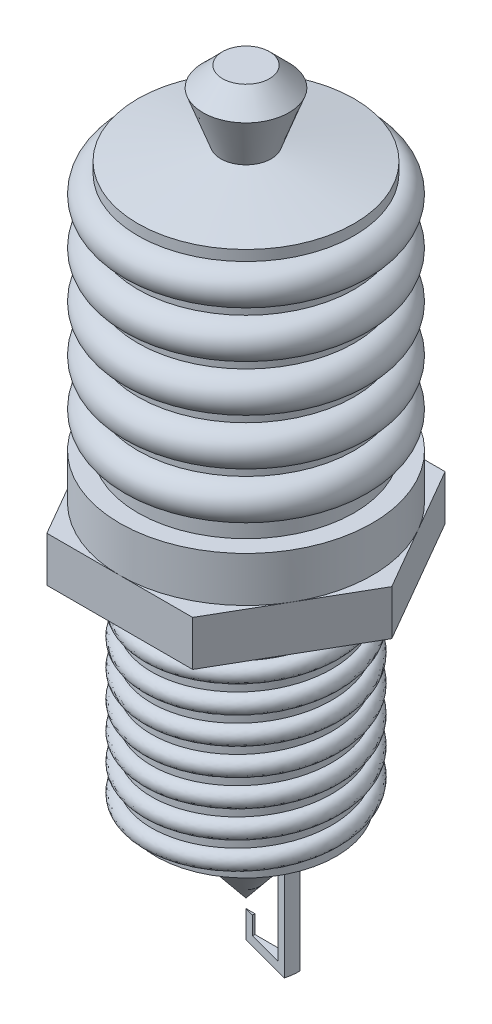
from build123d import *

# Parameters (mm, degrees)
BOSS_EXTRUDE1_DEPTH = 63.5
FILLET3_R           = 50.8
SKETCH3_R           = 177.8
BOSS_EXTRUDE2_DEPTH = 63.5
SWEEP1_PITCH        = 38.1
REVOLVE_THIN1_ANGLE = 15


with BuildPart() as part:
    # Sketch1 → Revolve1 (revolve)
    with BuildSketch(Plane.XY, mode=Mode.PRIVATE) as revolve1_sk:
        with BuildLine():
            Line((0, 1016), (0, 0))
            Line((0, 0), (92.71, 114.3))
            Line((92.71, 114.3), (127, 114.3))
            Line((127, 114.3), (127, 419.1))
            Line((127, 419.1), (88.9, 419.1))
            Line((88.9, 419.1), (88.9, 546.1))
            Line((88.9, 546.1), (152.4, 546.1))
            Line((152.4, 546.1), (152.4, 571.217955574))
            ThreePointArc((152.4, 571.217955574), (177.8, 596.617955574), (152.4, 622.017955574))
            Line((152.4, 622.017955574), (152.4, 636.749955574))
            ThreePointArc((152.4, 636.749955574), (177.8, 662.149955574), (152.4, 687.549955574))
            Line((152.4, 687.549955574), (152.4, 702.281955574))
            ThreePointArc((152.4, 702.281955574), (177.8, 727.681955574), (152.4, 753.081955574))
            Line((152.4, 753.081955574), (152.4, 767.813955574))
            ThreePointArc((152.4, 767.813955574), (177.8, 793.213955574), (152.4, 818.613955574))
            Line((152.4, 818.613955574), (152.4, 833.345955574))
            ThreePointArc((152.4, 833.345955574), (177.8, 858.745955574), (152.4, 884.145955574))
            Line((152.4, 884.145955574), (152.4, 898.877955574))
            Line((152.4, 898.877955574), (35.56, 919.48))
            Line((35.56, 919.48), (60.638203143, 988.381796857))
            Line((60.638203143, 988.381796857), (33.02, 1016))
            Line((33.02, 1016), (0, 1016))
        make_face()
    revolve(revolve1_sk.sketch.rotate(Axis((0, 1016, 0), (0, -1, 0)), 90), axis=Axis((0, 1016, 0), (0, -1, 0)))

    # Sketch2 → Boss-Extrude1 (add)
    with BuildSketch(Plane(origin=(0, 419.1, 0), x_dir=(1, 0, 0), z_dir=(0, 1, 0))):
        Polygon((102.652877862, 177.8), (-102.652877862, 177.8), (-205.305755724, 0), (-102.652877862, -177.8), (102.652877862, -177.8), (205.305755724, 0), align=None)
    extrude(amount=BOSS_EXTRUDE1_DEPTH)

    # Fillet3
    fillet3_edges = [part.edges().sort_by_distance(p)[0] for p in [
        (0, 114.3, -92.71),
    ]]
    fillet(fillet3_edges, radius=FILLET3_R)

    # Sketch3 → Boss-Extrude2 (add)
    with BuildSketch(Plane(origin=(0, 482.6, 0), x_dir=(1, 0, 0), z_dir=(0, 1, 0))):
        with Locations(Location((0, 0, 0), (0, 0, 270))):
            Circle(SKETCH3_R)
    extrude(amount=BOSS_EXTRUDE2_DEPTH)

    # Sweep1: arcs per turn and ends read off the stored shape
    # Sweep1: the profile of Sketch10 screwed along a right-hand helix through 7.75 turns, 24 arcs to a turn; built about Z, then put on its axis
    sweep1_z = Axis((0, 0, 0), (0, 0, 1))
    sweep1_corners = [(114.3, -0.002356687, 0.049358328), (127, -0.608047009, 12.734906769), (139.7, -0.002356687, 0.049358328), (127, 0.603333635, -12.636190112)]
    with BuildLine(mode=Mode.PRIVATE) as sweep1_profile:
        ThreePointArc((114.3, -0.002356687, 0.049358328), (118.019743879, -0.430644421, 9.019395653), (127, -0.608047009, 12.734906769))
        ThreePointArc((127, -0.608047009, 12.734906769), (135.980256121, -0.430644421, 9.019395653), (139.7, -0.002356687, 0.049358328))
        ThreePointArc((139.7, -0.002356687, 0.049358328), (135.980256121, 0.425931047, -8.920678997), (127, 0.603333635, -12.636190112))
        ThreePointArc((127, 0.603333635, -12.636190112), (118.019743879, 0.425931047, -8.920678997), (114.3, -0.002356687, 0.049358328))
    sweep1_cap = Face(sweep1_profile.wire())
    sweep1_arcs = [((114.3, -0.002356687, 0.049358328), (114.3, -0.608047009, 12.734906769), (127, -0.608047009, 12.734906769), (1, 0.7071067811865475, 1)), ((127, -0.608047009, 12.734906769), (139.7, -0.608047009, 12.734906769), (139.7, -0.002356687, 0.049358328), (1, 0.7071067811865475, 1)), ((139.7, -0.002356687, 0.049358328), (139.7, 0.603333635, -12.636190112), (127, 0.603333635, -12.636190112), (1, 0.7071067811865475, 1)), ((127, 0.603333635, -12.636190112), (114.3, 0.603333635, -12.636190112), (114.3, -0.002356687, 0.049358328), (1, 0.7071067811865475, 1))]  # start, shoulder, end, weights
    sweep1_turn_angles = [0, 7.5, 15, 22.5, 30, 37.5, 45, 52.5, 60, 67.5, 75, 82.5, 90, 97.5, 105, 112.5, 120, 127.5, 135, 142.5, 150, 157.5, 165, 172.5, 180, 187.5, 195, 202.5, 210, 217.5, 225, 232.5, 240, 247.5, 255, 262.5, 270, 277.5, 285, 292.5, 300, 307.5, 315, 322.5, 330, 337.5, 345, 352.5, 360]
    sweep1_turn_weights = [1, 0.9914448613738104, 1, 0.9914448613738104, 1, 0.9914448613738104, 1, 0.9914448613738104, 1, 0.9914448613738104, 1, 0.9914448613738104, 1, 0.9914448613738104, 1, 0.9914448613738104, 1, 0.9914448613738104, 1, 0.9914448613738104, 1, 0.9914448613738104, 1, 0.9914448613738104, 1, 0.9914448613738104, 1, 0.9914448613738104, 1, 0.9914448613738104, 1, 0.9914448613738104, 1, 0.9914448613738104, 1, 0.9914448613738104, 1, 0.9914448613738104, 1, 0.9914448613738104, 1, 0.9914448613738104, 1, 0.9914448613738104, 1, 0.9914448613738104, 1, 0.9914448613738104, 1]
    sweep1_turn_sides = [Face.make_bezier_surface([[Vector(p[j][0], p[j][1], 0).rotate(sweep1_z, sweep1_turn_angles[2 * i + k]) / sweep1_turn_weights[2 * i + k] + Vector(0, 0, p[j][2] + SWEEP1_PITCH * sweep1_turn_angles[2 * i + k] / 360) for k in range(3)] for j in range(3)], [[p[3][j] * sweep1_turn_weights[2 * i + k] for k in range(3)] for j in range(3)]) for p in sweep1_arcs for i in range(24)]
    sweep1_last_angles = [2520, 2527.5, 2535, 2542.5, 2550, 2557.5, 2565, 2572.5, 2580, 2587.5, 2595, 2602.5, 2610, 2617.5, 2625, 2632.5, 2640, 2647.5, 2655, 2662.5, 2670, 2677.5, 2685, 2692.5, 2700, 2707.5, 2715, 2722.5, 2730, 2737.5, 2745, 2752.5, 2760, 2767.5, 2775, 2782.5, 2790]
    sweep1_last_weights = [1, 0.9914448613738104, 1, 0.9914448613738104, 1, 0.9914448613738104, 1, 0.9914448613738104, 1, 0.9914448613738104, 1, 0.9914448613738104, 1, 0.9914448613738104, 1, 0.9914448613738104, 1, 0.9914448613738104, 1, 0.9914448613738104, 1, 0.9914448613738104, 1, 0.9914448613738104, 1, 0.9914448613738104, 1, 0.9914448613738104, 1, 0.9914448613738104, 1, 0.9914448613738104, 1, 0.9914448613738104, 1, 0.9914448613738115, 1]
    sweep1_last_sides = [Face.make_bezier_surface([[Vector(p[j][0], p[j][1], 0).rotate(sweep1_z, sweep1_last_angles[2 * i + k]) / sweep1_last_weights[2 * i + k] + Vector(0, 0, p[j][2] + SWEEP1_PITCH * sweep1_last_angles[2 * i + k] / 360) for k in range(3)] for j in range(3)], [[p[3][j] * sweep1_last_weights[2 * i + k] for k in range(3)] for j in range(3)]) for p in sweep1_arcs for i in range(18)]
    sweep1 = Plane(origin=(0, 114.3, 0), x_dir=(0, 0, -1), z_dir=(0, 1, 0)) * Solid(Shell([*[p.moved(Location((0, 0, SWEEP1_PITCH * i))) for i in range(7) for p in sweep1_turn_sides], *sweep1_last_sides, sweep1_cap, sweep1_cap.rotate(sweep1_z, 2790).moved(Location((0, 0, SWEEP1_PITCH * 2790 / 360)))]))
    add(sweep1)

    # Sketch11 → Revolve-Thin1 (revolve)
    with BuildSketch(Plane.XY):
        Polygon((0, -12.7), (0, -50.8), (76.2, -50.8), (76.2, 114.3), (63.5, 114.3), (63.5, -38.1), (12.7, -38.1), (12.7, -12.7), align=None)
    revolve(axis=Axis((0, -12.7, 0), (0, -1, 0)), revolution_arc=REVOLVE_THIN1_ANGLE)


solid = part.part
